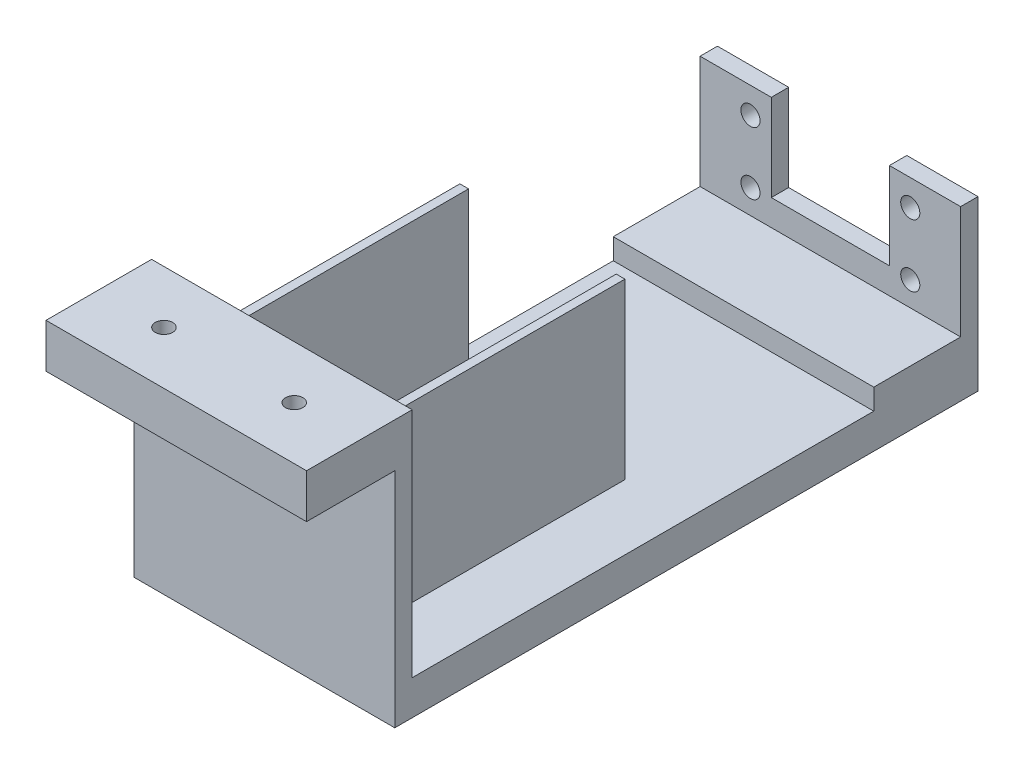
from build123d import *

# Parameters (mm, degrees)
SKETCH1_R                = 2.75
BOSS_EXTRUDE1_DEPTH      = 5
BOSS_EXTRUDE2_DEPTH      = 25
BOSS_EXTRUDE2_DEPTH_BACK = 5
SKETCH2_W                = 75
SKETCH2_H                = 6
SKETCH3_W                = 75
SKETCH3_H                = 10
BOSS_EXTRUDE3_DEPTH      = 167.8942
SKETCH4_W                = 75
SKETCH4_H                = 5
BOSS_EXTRUDE4_DEPTH      = 66.8
SKETCH5_W                = 75
SKETCH5_H                = 12.7
BOSS_EXTRUDE5_DEPTH      = 25.4
M5X0_8_TAPPED_HOLE1_D    = 5
SKETCH8_W                = 2.5
SKETCH8_H                = 50
BOSS_EXTRUDE6_DEPTH      = 75


with BuildPart() as part:
    # Sketch1 → Boss-Extrude1 (new body)
    with BuildSketch(Plane.XY):
        Polygon((20.5, 7.5), (20.5, 32.5), (0, 32.5), (0, 0), (75, 0), (75, 32.5), (54.5, 32.5), (54.5, 7.5), align=None)
        with Locations((14.5, 7)):
            Circle(SKETCH1_R, mode=Mode.SUBTRACT)
        with Locations((14.5, 25)):
            Circle(SKETCH1_R, mode=Mode.SUBTRACT)
        with Locations((60.5, 25)):
            Circle(SKETCH1_R, mode=Mode.SUBTRACT)
        with Locations((60.5, 7)):
            Circle(SKETCH1_R, mode=Mode.SUBTRACT)
    extrude(amount=BOSS_EXTRUDE1_DEPTH)

    # Sketch2 → Boss-Extrude2 (add, two sides: drawn at the far end of the back side and taken through both)
    with BuildSketch(Plane.XY.offset(5).offset(-BOSS_EXTRUDE2_DEPTH_BACK)):
        with Locations((37.5, -3)):
            Rectangle(SKETCH2_W, SKETCH2_H)
    extrude(amount=BOSS_EXTRUDE2_DEPTH + BOSS_EXTRUDE2_DEPTH_BACK)

    # Sketch3 → Boss-Extrude3 (add)
    with BuildSketch(Plane(origin=(0, 0, 0), x_dir=(-1, 0, 0), z_dir=(0, 0, -1))):
        with Locations((-37.5, -11)):
            Rectangle(SKETCH3_W, SKETCH3_H)
    extrude(amount=-BOSS_EXTRUDE3_DEPTH)

    # Sketch4 → Boss-Extrude4 (add)
    with BuildSketch(Plane(origin=(0, -6, 0), x_dir=(1, 0, 0), z_dir=(0, 1, 0))):
        with Locations((37.5, -165.3942)):
            Rectangle(SKETCH4_W, SKETCH4_H)
    extrude(amount=BOSS_EXTRUDE4_DEPTH)

    # Sketch5 → Boss-Extrude5 (add)
    with BuildSketch(Plane.XY.offset(167.8942)):
        with Locations((37.5, 54.45)):
            Rectangle(SKETCH5_W, SKETCH5_H)
    extrude(amount=BOSS_EXTRUDE5_DEPTH)

    # M5x0.8 Tapped Hole1 (through all)
    with Locations(Plane(origin=(0, 60.8, 0), x_dir=(1, 0, 0), z_dir=(0, 1, 0))):
        with Locations((56.25, -178.0942), (18.75, -178.0942)):
            Hole(M5X0_8_TAPPED_HOLE1_D / 2)

    # Sketch8 → Boss-Extrude6 (add)
    with BuildSketch(Plane(origin=(0, 0, 162.8942), x_dir=(-1, 0, 0), z_dir=(0, 0, -1))):
        with Locations((-60, 24)):
            Rectangle(SKETCH8_W, SKETCH8_H)
        with Locations((-15, 24)):
            Rectangle(SKETCH8_W, SKETCH8_H)
    extrude(amount=BOSS_EXTRUDE6_DEPTH)


solid = part.part
